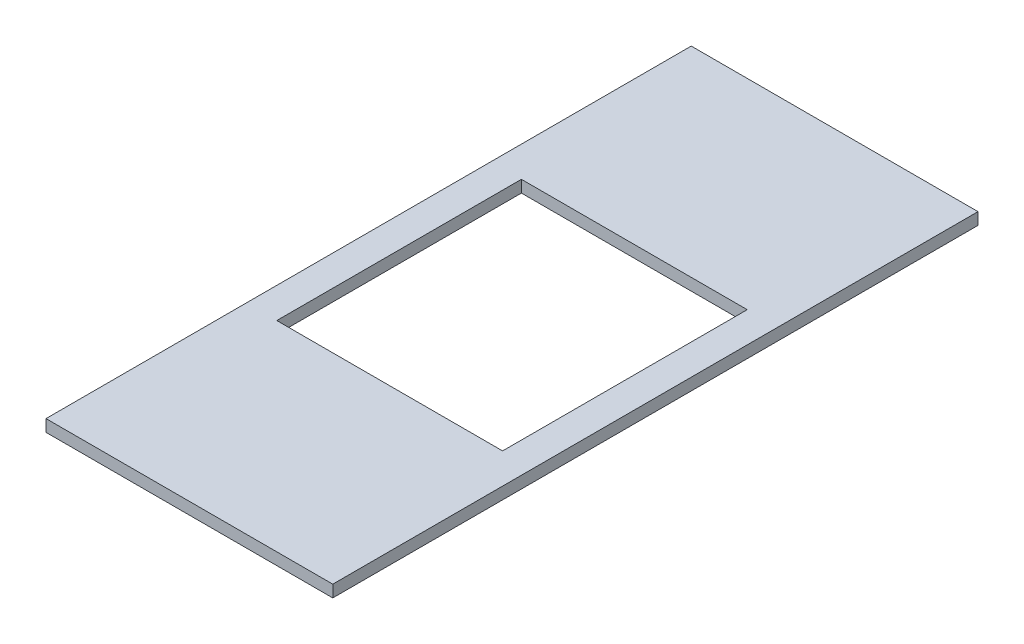
from build123d import *

# Parameters (mm, degrees)
SKETCH1_W           = 152.4
SKETCH1_H           = 342.9
SKETCH1_W_2         = 120
SKETCH1_H_2         = 130
BOSS_EXTRUDE1_DEPTH = 6.35


with BuildPart() as part:
    # Sketch1 → Boss-Extrude1 (new body)
    with BuildSketch(Plane(origin=(0, 0, 0), x_dir=(1, 0, 0), z_dir=(0, 1, 0))):
        with Locations((76.2, 171.45)):
            Rectangle(SKETCH1_W, SKETCH1_H)
        with Locations((76.2, 171.45)):
            Rectangle(SKETCH1_W_2, SKETCH1_H_2, mode=Mode.SUBTRACT)
    extrude(amount=BOSS_EXTRUDE1_DEPTH)


solid = part.part
